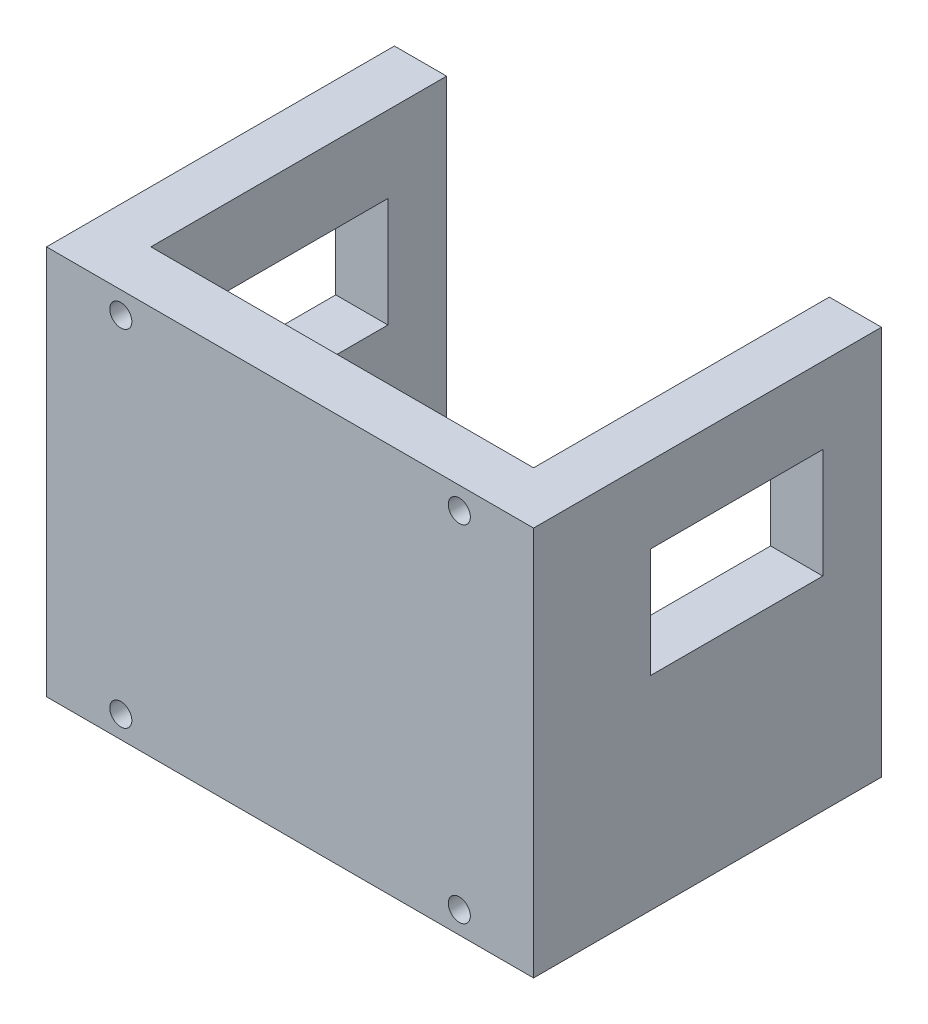
from build123d import *

# Parameters (mm, degrees)
ESQUISSE1_W               = 140
ESQUISSE1_H               = 112
BOSS_EXTRU_1_DEPTH        = 100
ESQUISSE2_W               = 110
ESQUISSE2_H               = 85
ENL_V_MAT_EXTRU_1_DEPTH   = 186.851392651
ESQUISSE3_W               = 49.5
ESQUISSE3_H               = 31.5
ENL_V_MAT_EXTRU_2_DEPTH   = 203.91565233
ESQUISSE4_R               = 3.175
ENL_V_MAT_EXTRU_3_DEPTH   = 176.489321928
SYM_TRIE2_COPY_1_SKETCH_R = 3.175
SYM_TRIE2_COPY_1_DEPTH    = 176.489321928


with BuildPart() as part:
    # Esquisse1 → Boss.-Extru.1 (new body)
    with BuildSketch(Plane.XY):
        with Locations((-39.52963138, -51.586067687)):
            Rectangle(ESQUISSE1_W, ESQUISSE1_H)
    extrude(amount=BOSS_EXTRU_1_DEPTH)

    # Esquisse2 → Enlèv. mat.-Extru.1 (cut, through all)
    with BuildSketch(Plane(origin=(0, 4.413932313, 0), x_dir=(1, 0, 0), z_dir=(0, 1, 0))):
        with Locations((-39.52963138, -42.5)):
            Rectangle(ESQUISSE2_W, ESQUISSE2_H)
    extrude(amount=-ENL_V_MAT_EXTRU_1_DEPTH, mode=Mode.SUBTRACT)

    # Esquisse3 → Enlèv. mat.-Extru.2 (cut, through all)
    with BuildSketch(Plane.ZY.offset(109.52963138)):
        with Locations((41.617518417, -33.34820443)):
            Rectangle(ESQUISSE3_W, ESQUISSE3_H)
    extrude(amount=-ENL_V_MAT_EXTRU_2_DEPTH, mode=Mode.SUBTRACT)

    # Esquisse4 → Enlèv. mat.-Extru.3 (cut, through all)
    with BuildSketch(Plane(origin=(0, 0, 85), x_dir=(-1, 0, 0), z_dir=(0, 0, -1))):
        with Locations((-9.12036862, -1.936067687)):
            Circle(ESQUISSE4_R)
    enl_v_mat_extru_3 = extrude(amount=-ENL_V_MAT_EXTRU_3_DEPTH, mode=Mode.SUBTRACT)

    # Symétrie1: Enlèv. mat.-Extru.3 across plane
    add(enl_v_mat_extru_3.mirror(Plane(origin=(-39.52963138, 0, 0), x_dir=(0, 0, 1), z_dir=(1, 0, 0))), mode=Mode.SUBTRACT)

    # Symétrie2: Enlèv. mat.-Extru.3 across plane
    add(enl_v_mat_extru_3.mirror(Plane(origin=(0, -51.586067687, 0), x_dir=(0, 0, 1), z_dir=(0, -1, 0))), mode=Mode.SUBTRACT)

    # Symétrie2 copy 1 sketch → Symétrie2 copy 1 (cut, through all)
    with BuildSketch(Plane(origin=(-79.05926276, -103.172135375, 85), x_dir=(1, 0, 0), z_dir=(0, 0, -1))):
        with Locations((-9.12036862, -1.936067687)):
            Circle(SYM_TRIE2_COPY_1_SKETCH_R)
    extrude(amount=-SYM_TRIE2_COPY_1_DEPTH, mode=Mode.SUBTRACT)


solid = part.part
